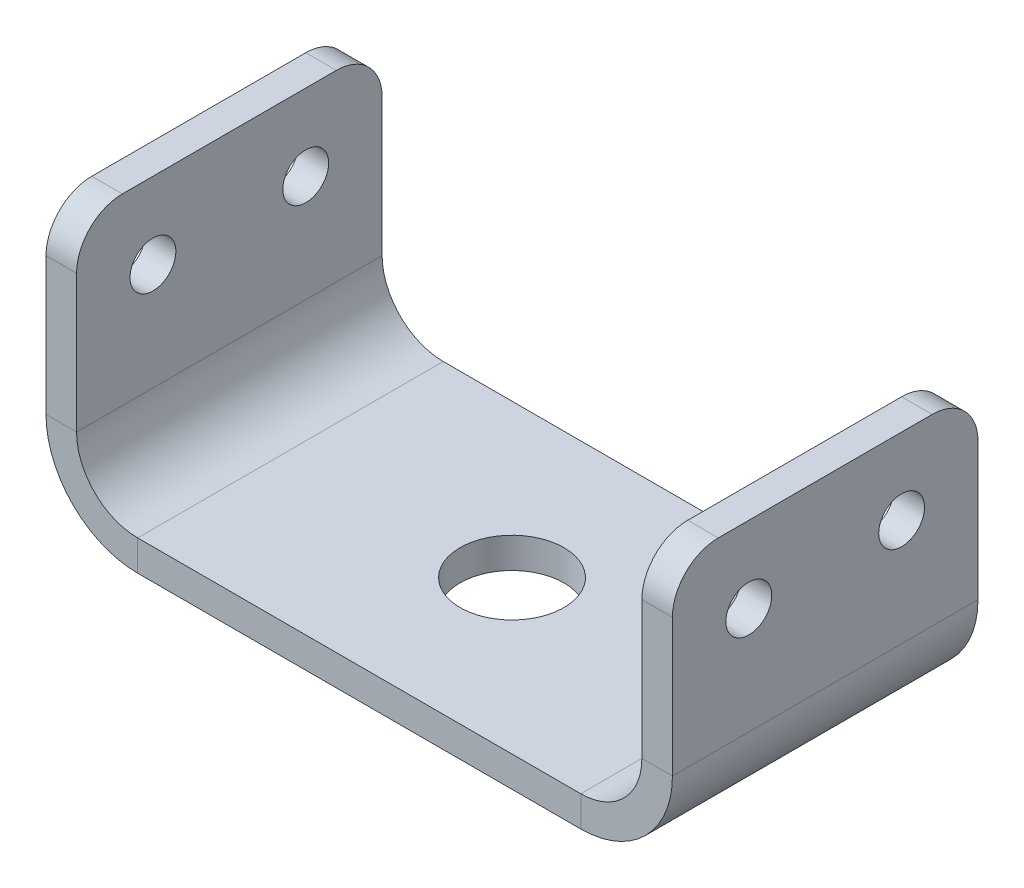
from build123d import *

# Parameters (mm, degrees)
SKETCH1_W            = 20
SKETCH1_H            = 6
BOSS_EXTRUDE1_DEPTH  = 20.5
SKETCH2_W            = 3
SKETCH2_H            = 20
BOSS_EXTRUDE2_DEPTH  = 12
SKETCH7_R            = 1.5
CUT_EXTRUDE1_DEPTH   = 44.874821937
SKETCH8_R            = 3.4
CUT_EXTRUDE2_DEPTH   = 30.055980452
FILLET2_R            = 3
CONVERT_SOLID2_START = -10
CONVERT_SOLID2_DEPTH = 20


# Read off the part's stored shape, not the designer's step: Convert-Solid2
with BuildPart() as part:
    # Sketch1 → Boss-Extrude1 (new, symmetric)
    with BuildSketch(Plane(origin=(0, 0, 0), x_dir=(0, 0, -1), z_dir=(1, 0, 0))):
        with Locations((0, -3)):
            Rectangle(SKETCH1_W, SKETCH1_H)
    extrude(amount=BOSS_EXTRUDE1_DEPTH, both=True)

    # Sketch2 → Boss-Extrude2 (add)
    with BuildSketch(Plane(origin=(0, 0, 0), x_dir=(1, 0, 0), z_dir=(0, 1, 0))):
        with Locations((19, 0)):
            Rectangle(SKETCH2_W, SKETCH2_H)
        with Locations((-19, 0)):
            Rectangle(SKETCH2_W, SKETCH2_H)
    extrude(amount=BOSS_EXTRUDE2_DEPTH)

    # Sketch7 → Cut-Extrude1 (cut, through all)
    with BuildSketch(Plane.ZY.offset(20.5)):
        with Locations((-5, 7)):
            Circle(SKETCH7_R)
        with Locations((5, 7)):
            Circle(SKETCH7_R)
    extrude(amount=-CUT_EXTRUDE1_DEPTH, mode=Mode.SUBTRACT)

    # Sketch8 → Cut-Extrude2 (cut, through all)
    with BuildSketch(Plane.XZ.offset(6)):
        with Locations(Location((0, 0, 0), (0, 0, 270))):
            Circle(SKETCH8_R)
    extrude(amount=-CUT_EXTRUDE2_DEPTH, mode=Mode.SUBTRACT)

    # Fillet2
    fillet2_edges = [part.edges().sort_by_distance(p)[0] for p in [
        (-19, 12, 10),
        (-19, 12, -10),
        (19, 12, -10),
        (19, 12, 10),
    ]]
    fillet(fillet2_edges, radius=FILLET2_R)

    # Convert-Solid2 outline → Convert-Solid2 (cut)
    with BuildSketch(Plane.XY.offset(CONVERT_SOLID2_START)):
        with BuildLine():
            Line((20.5, -6), (20.5, 0))
            ThreePointArc((20.5, 0), (18.742640687, -4.242640687), (14.5, -6))
            Line((14.5, -6), (20.5, -6))
        make_face()
        with BuildLine():
            Line((-20.5, -6), (-14.5, -6))
            ThreePointArc((-14.5, -6), (-18.742640687, -4.242640687), (-20.5, 0))
            Line((-20.5, 0), (-20.5, -6))
        make_face()
        with BuildLine():
            Line((18.5, 0), (18.5, 12))
            Line((18.5, 12), (17.5, 12))
            Line((17.5, 12), (17.5, 0))
            Line((17.5, 0), (-17.5, 0))
            Line((-17.5, 0), (-17.5, 12))
            Line((-17.5, 12), (-18.5, 12))
            Line((-18.5, 12), (-18.5, 0))
            ThreePointArc((-18.5, 0), (-17.328427125, -2.828427125), (-14.5, -4))
            Line((-14.5, -4), (14.5, -4))
            ThreePointArc((14.5, -4), (17.328427125, -2.828427125), (18.5, 0))
        make_face()
    extrude(amount=CONVERT_SOLID2_DEPTH, mode=Mode.SUBTRACT)


solid = part.part
